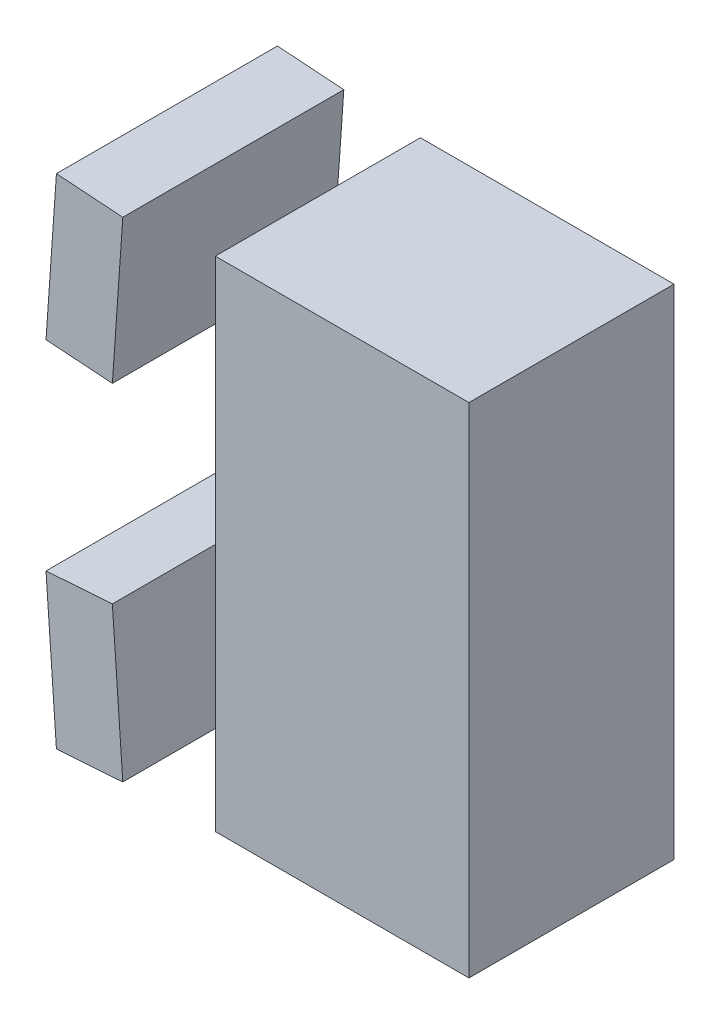
from build123d import *

# Parameters (mm, degrees)
BODY_DEPTH                     = 19.05
SKETCH4_R                      = 5.9436
F_10_HEAD_CLEARANCE_DEPTH      = 48.971655672
F_10_NUT_CLEARANCE_DEPTH       = 46.868801757
F_10_NUT_CLEARANCE_DEPTH_BACK  = 4.7625
FILLET2_R                      = 8.89
F_10_CLEARANCE_HOLE1_D         = 5.1054
FILLET3_R                      = 5.08
FILLET4_R                      = 2.54
F_10_CLEARANCE_HOLE2_D         = 5.1054
SKETCH11_W                     = 23.92163958
SKETCH11_H                     = 16.170942948
INFILL_BOX_MOUNT_DEPTH         = 7.2008
INFILL_BOUNDING_BOX_DEPTH      = 26.969445
INFILL_BOUNDING_BOX_DEPTH_BACK = 26.969445
SKETCH9_W                      = 27.451683019
SKETCH9_H                      = 22.196172726


# Read off the part's stored shape, not the designer's step: Body
with BuildPart() as part:
    # Body outline → Body (new body)
    with BuildSketch(Plane.XY):
        with BuildLine():
            ThreePointArc((19.563256599, 8.1915), (16.002518677, 13.919090379), (10.823670896, 18.239238727))
            Line((10.823670896, 18.239238727), (11.330509573, 25.487369503))
            Line((11.330509573, 25.487369503), (1.828711995, 26.151799916))
            Line((1.828711995, 26.151799916), (0.815034639, 11.655538363))
            ThreePointArc((0.815034639, 11.655538363), (11.684, 0), (0.815034639, -11.655538363))
            Line((0.815034639, -11.655538363), (1.828711995, -26.151799916))
            Line((1.828711995, -26.151799916), (11.330509573, -25.487369503))
            Line((11.330509573, -25.487369503), (10.823670896, -18.239238727))
            ThreePointArc((10.823670896, -18.239238727), (16.002518677, -13.919090379), (19.563256599, -8.1915))
            Line((19.563256599, -8.1915), (41.469504125, -8.1915))
            Line((41.469504125, -8.1915), (41.469504125, -5.0165))
            Line((41.469504125, -5.0165), (20.607193131, -5.0165))
            ThreePointArc((20.607193131, -5.0165), (20.948626487, -3.313114744), (21.149504125, -1.5875))
            Line((21.149504125, -1.5875), (41.469504125, -1.5875))
            Line((41.469504125, -1.5875), (41.469504125, 1.5875))
            Line((41.469504125, 1.5875), (21.149504125, 1.5875))
            ThreePointArc((21.149504125, 1.5875), (20.948626487, 3.313114744), (20.607193131, 5.0165))
            Line((20.607193131, 5.0165), (41.469504125, 5.0165))
            Line((41.469504125, 5.0165), (41.469504125, 8.1915))
            Line((41.469504125, 8.1915), (19.563256599, 8.1915))
        make_face()
    extrude(amount=BODY_DEPTH)

    # Sketch3 → CBORE for #10 Binding Head Machine Screw1 (revolve, cut)
    with BuildSketch(Plane(origin=(10.823670896, -18.239238727, 9.525), x_dir=(-0.06975647374412856, 0.9975640502598241, 0), z_dir=(0, 0, 1))):
        Polygon((0, 0), (0, 10.536208088), (2.5527, 10.536208088), (2.5527, 3.1242), (5.9436, 3.1242), (5.9436, 0), align=None)
    revolve(axis=Axis((17.158202615, -17.796285119, 9.525), (-0.9975640502598241, -0.06975647374412855, 0)), mode=Mode.SUBTRACT)

    # Sketch4 → #10 Head clearance (cut, through all)
    with BuildSketch(Plane(origin=(6.385207973, 0.446497237, 0), x_dir=(-0.06975647374412856, 0.9975640502598241, 0), z_dir=(0.9975640502598241, 0.06975647374412856, 0))):
        with Locations((-18.949829973, 9.525)):
            Circle(SKETCH4_R)
    extrude(amount=F_10_HEAD_CLEARANCE_DEPTH, mode=Mode.SUBTRACT)

    # Sketch5 → #10 nut clearance (cut, two sides: drawn at the far end of the back side and taken through both)
    with BuildSketch(Plane(origin=(9.501797579, -0.664430412, 0), x_dir=(-0.06975647374412855, -0.9975640502598241, 0), z_dir=(0.9975640502598241, -0.06975647374412855, 0)).offset(-F_10_NUT_CLEARANCE_DEPTH_BACK)):
        Polygon((-23.902829973, -6.665384117), (-23.902829973, -12.384615883), (-18.949829973, -15.244231767), (-13.996829973, -12.384615883), (-13.996829973, -6.665384117), (-18.949829973, -3.805768233), align=None)
    extrude(amount=F_10_NUT_CLEARANCE_DEPTH + F_10_NUT_CLEARANCE_DEPTH_BACK, mode=Mode.SUBTRACT)

    # Fillet2
    fillet2_edges = [part.edges().sort_by_distance(p)[0] for p in [
        (41.469504125, 6.604, 0),
        (41.469504125, 0, 0),
        (41.469504125, -6.604, 0),
        (41.469504125, -6.604, 19.05),
        (41.469504125, 0, 19.05),
        (41.469504125, 6.604, 19.05),
    ]]
    fillet(fillet2_edges, radius=FILLET2_R)

    # #10 Clearance Hole1 (through all)
    with Locations(Plane(origin=(0, -8.1915, 0), x_dir=(-1, 0, 0), z_dir=(0, -1, 0))):
        with Locations((-31.944504125, -9.525)):
            Hole(F_10_CLEARANCE_HOLE1_D / 2)

    # Fillet3
    fillet3_edges = [part.edges().sort_by_distance(p)[0] for p in [
        (19.563256599, 8.1915, 9.525),
        (19.563256599, -8.1915, 9.525),
    ]]
    fillet(fillet3_edges, radius=FILLET3_R)

    # Fillet4
    # the kernel refuses this fillet: 2.54 mm, written as the material it adds along each edge
    with BuildSketch(Plane(origin=(10.823670896, 18.239238727, 0), x_dir=(0.06975647364615441, 0.997564050266675, 0), z_dir=(0, 0, 1))) as fillet4_piece_1_section:
        with BuildLine():
            CenterArc((1.506239444, -2.54), FILLET4_R, 90, 59.467874794)
            ThreePointArc((-0.681575467, -1.249625668), (-0.330301403, -0.630532327), (0, 0))
            Line((0, 0), (1.506239444, 0))
        make_face()
    fillet4_piece_1 = extrude(amount=7.571366843, mode=Mode.PRIVATE)
    fillet4_piece_1 = split(fillet4_piece_1, bisect_by=Plane(origin=(11.045496334, 17.483235197, 3.379286412), z_dir=(0.034878236872064254, 0.49878202512991177, -0.8660254037844389)), keep=Keep.TOP, mode=Mode.PRIVATE)
    fillet4_piece_1 = split(fillet4_piece_1, bisect_by=Plane(origin=(11.16675059, 19.217251842, 3.228670408), z_dir=(-0.0348782368720643, -0.49878202512991243, -0.8660254037844384)), keep=Keep.TOP, mode=Mode.PRIVATE)
    add(fillet4_piece_1)
    with BuildSketch(Plane(origin=(10.823670896, 18.239238727, 0), x_dir=(0.06975647364615441, 0.997564050266675, 0), z_dir=(0, 0, 1))) as fillet4_piece_2_section:
        with BuildLine():
            CenterArc((1.506239444, -2.54), FILLET4_R, 90, 59.467874794)
            ThreePointArc((-0.681575467, -1.249625668), (-0.330301403, -0.630532327), (0, 0))
            Line((0, 0), (1.506239444, 0))
        make_face()
    fillet4_piece_2 = extrude(amount=7.571366843, mode=Mode.PRIVATE)
    fillet4_piece_2 = split(fillet4_piece_2, bisect_by=Plane(origin=(11.538192523, 17.902598899, 3.640659173), z_dir=(-0.034878236872064254, -0.49878202512991177, 0.8660254037844389)), keep=Keep.TOP, mode=Mode.PRIVATE)
    fillet4_piece_2 = split(fillet4_piece_2, bisect_by=Plane(origin=(11.538192523, 17.902598899, 3.970877294), z_dir=(-0.0348782368720643, -0.49878202512991243, -0.8660254037844384)), keep=Keep.TOP, mode=Mode.PRIVATE)
    add(fillet4_piece_2)
    with BuildSketch(Plane(origin=(10.823670896, 18.239238727, 0), x_dir=(0.06975647364615441, 0.997564050266675, 0), z_dir=(0, 0, 1))) as fillet4_piece_3_section:
        with BuildLine():
            CenterArc((1.506239444, -2.54), FILLET4_R, 90, 59.467874794)
            ThreePointArc((-0.681575467, -1.249625668), (-0.330301403, -0.630532327), (0, 0))
            Line((0, 0), (1.506239444, 0))
        make_face()
    fillet4_piece_3 = extrude(amount=7.571366843, mode=Mode.PRIVATE)
    fillet4_piece_3 = split(fillet4_piece_3, bisect_by=Plane(origin=(10.910701379, 18.802736053, 4.133816124), z_dir=(0.034878236872064254, 0.49878202512991177, -0.8660254037844389)), keep=Keep.TOP, mode=Mode.PRIVATE)
    fillet4_piece_3 = split(fillet4_piece_3, bisect_by=Plane(origin=(10.910701379, 18.802736053, 3.477720343), z_dir=(0.0348782368720643, 0.49878202512991243, 0.8660254037844384)), keep=Keep.TOP, mode=Mode.PRIVATE)
    add(fillet4_piece_3)
    with BuildSketch(Plane(origin=(10.823670896, 18.239238727, 11.478633157), x_dir=(0.06975647364615441, 0.997564050266675, 0), z_dir=(0, 0, 1))) as fillet4_piece_4_section:
        with BuildLine():
            CenterArc((1.506239444, -2.54), FILLET4_R, 90, 59.467874794)
            ThreePointArc((-0.681575467, -1.249625668), (-0.330301403, -0.630532327), (0, 0))
            Line((0, 0), (1.506239444, 0))
        make_face()
    fillet4_piece_4 = extrude(amount=7.571366843, mode=Mode.PRIVATE)
    fillet4_piece_4 = split(fillet4_piece_4, bisect_by=Plane(origin=(11.538192523, 17.902598899, 15.409340827), z_dir=(-0.03487823687206431, -0.4987820251299125, -0.8660254037844386)), keep=Keep.TOP, mode=Mode.PRIVATE)
    fillet4_piece_4 = split(fillet4_piece_4, bisect_by=Plane(origin=(11.538192523, 17.902598899, 15.079122706), z_dir=(-0.034878236872064254, -0.49878202512991177, 0.8660254037844388)), keep=Keep.TOP, mode=Mode.PRIVATE)
    add(fillet4_piece_4)
    with BuildSketch(Plane(origin=(10.823670896, 18.239238727, 11.478633157), x_dir=(0.06975647364615441, 0.997564050266675, 0), z_dir=(0, 0, 1))) as fillet4_piece_5_section:
        with BuildLine():
            CenterArc((1.506239444, -2.54), FILLET4_R, 90, 59.467874794)
            ThreePointArc((-0.681575467, -1.249625668), (-0.330301403, -0.630532327), (0, 0))
            Line((0, 0), (1.506239444, 0))
        make_face()
    fillet4_piece_5 = extrude(amount=7.571366843, mode=Mode.PRIVATE)
    fillet4_piece_5 = split(fillet4_piece_5, bisect_by=Plane(origin=(10.910701379, 18.802736053, 14.916183876), z_dir=(0.03487823687206431, 0.4987820251299125, 0.8660254037844386)), keep=Keep.TOP, mode=Mode.PRIVATE)
    fillet4_piece_5 = split(fillet4_piece_5, bisect_by=Plane(origin=(10.910701379, 18.802736053, 15.572279657), z_dir=(0.034878236872064254, 0.49878202512991177, -0.8660254037844388)), keep=Keep.TOP, mode=Mode.PRIVATE)
    add(fillet4_piece_5)
    with BuildSketch(Plane(origin=(10.823670896, 18.239238727, 11.478633157), x_dir=(0.06975647364615441, 0.997564050266675, 0), z_dir=(0, 0, 1))) as fillet4_piece_6_section:
        with BuildLine():
            CenterArc((1.506239444, -2.54), FILLET4_R, 90, 59.467874794)
            ThreePointArc((-0.681575467, -1.249625668), (-0.330301403, -0.630532327), (0, 0))
            Line((0, 0), (1.506239444, 0))
        make_face()
    fillet4_piece_6 = extrude(amount=7.571366843, mode=Mode.PRIVATE)
    fillet4_piece_6 = split(fillet4_piece_6, bisect_by=Plane(origin=(11.045496334, 17.483235197, 15.670713588), z_dir=(0.03487823687206431, 0.4987820251299125, 0.8660254037844386)), keep=Keep.TOP, mode=Mode.PRIVATE)
    fillet4_piece_6 = split(fillet4_piece_6, bisect_by=Plane(origin=(11.16675059, 19.217251842, 15.821329592), z_dir=(-0.034878236872064254, -0.49878202512991177, 0.8660254037844388)), keep=Keep.TOP, mode=Mode.PRIVATE)
    add(fillet4_piece_6)
    with BuildSketch(Plane(origin=(10.823670896, -18.239238727, 0), x_dir=(0.8423668352181145, 0.5389045508479382, 0), z_dir=(0, 0, 1))) as fillet4_piece_7_section:
        with BuildLine():
            CenterArc((1.50864912, -2.538569498), FILLET4_R, 91.92302723, 59.467874794)
            Line((-0.721234541, -1.322338081), (0, 0))
            ThreePointArc((0, 0), (0.711707353, -0.011944694), (1.423414707, 0))
        make_face()
    fillet4_piece_7 = extrude(amount=7.34699861, mode=Mode.PRIVATE)
    fillet4_piece_7 = fillet4_piece_7 - Plane(origin=(11.093024208, -18.220403709, 9.525), x_dir=(-0.06975647374412856, 0.9975640502598241, 0), z_dir=(-0.9975640502598241, -0.06975647374412856, 0)) * Cylinder(5.9436, 21, mode=Mode.PRIVATE)
    add(fillet4_piece_7)
    with BuildSketch(Plane(origin=(10.823670896, -18.239238727, 11.70300139), x_dir=(0.8423668352181142, 0.5389045508479389, 0), z_dir=(0, 0, 1))) as fillet4_piece_8_section:
        with BuildLine():
            CenterArc((1.50864912, -2.538569498), FILLET4_R, 91.92302723, 59.467874794)
            Line((-0.721234541, -1.322338081), (0, 0))
            ThreePointArc((0, 0), (0.711707353, -0.011944694), (1.423414707, 0))
        make_face()
    fillet4_piece_8 = extrude(amount=7.34699861, mode=Mode.PRIVATE)
    fillet4_piece_8 = fillet4_piece_8 - Plane(origin=(11.09302416, -18.220403712, 9.525), x_dir=(-0.06975647374412856, 0.9975640502598241, 0), z_dir=(-0.9975640502598241, -0.06975647374412856, 0)) * Cylinder(5.9436, 21, mode=Mode.PRIVATE)
    add(fillet4_piece_8)
    # the kernel refuses this fillet: 2.54 mm, written as the material it takes off along each edge
    with BuildSketch(Plane(origin=(11.330509573, -25.487369503, -6.349999999), x_dir=(-0.06975647364615452, 0.997564050266675, 0), z_dir=(0, 0, 1)), Plane(origin=(11.330509573, 25.487369503, -6.349999999), x_dir=(-0.997564050255164, 0.06975647381076958, 0), z_dir=(0, 0, 1))) as fillet4_2_piece_1:
        with BuildLine():
            CenterArc((FILLET4_R, FILLET4_R), FILLET4_R, 180.000000009, 89.999999991)
            Line((-FILLET4_R * 1.65018418464e-10, FILLET4_R), (0, 0))
            Line((0, 0), (FILLET4_R, 0))
        make_face()
    extrude(amount=31.749999998, mode=Mode.SUBTRACT)
    with BuildSketch(Plane(origin=(1.828711995, -26.151799916, -6.35), x_dir=(0.9975640502551639, 0.0697564738107699, 0), z_dir=(0, 0, 1)), Plane(origin=(1.828711995, 26.151799916, -6.35), x_dir=(-0.06975647377832653, -0.9975640502574327, 0), z_dir=(0, 0, 1))) as fillet4_2_piece_2:
        with BuildLine():
            CenterArc((FILLET4_R, FILLET4_R), FILLET4_R, 179.999999998, 90.000000002)
            Line((0, FILLET4_R), (0, 0))
            Line((0, 0), (FILLET4_R, 0))
        make_face()
    extrude(amount=31.75, mode=Mode.SUBTRACT)
    with BuildSketch(Plane(origin=(0.815034639, -11.655538363, -5.778442378), x_dir=(0.06975647377832637, -0.9975640502574326, 0), z_dir=(0, 0, 1))) as fillet4_2_piece_3:
        with BuildLine():
            CenterArc((2.311376951, 2.54), FILLET4_R, 190.286560608, 79.713439392)
            ThreePointArc((-0.187797504, 2.086428572), (-0.047044084, 1.047431631), (0, 0))
            Line((0, 0), (2.311376951, 0))
        make_face()
    extrude(amount=30.606884756, mode=Mode.SUBTRACT)
    with BuildSketch(Plane(origin=(0.815034639, 11.655538363, -5.778442378), x_dir=(0.9872940550084358, -0.1589038984575255, 0), z_dir=(0, 0, 1))) as fillet4_2_piece_4:
        with BuildLine():
            CenterArc((2.322565791, 2.529773025), FILLET4_R, 185.143280302, 79.713439392)
            Line((-0.207207235, 2.302070497), (0, 0))
            ThreePointArc((0, 0), (1.047431631, 0.047044085), (2.094863262, 0))
        make_face()
    extrude(amount=30.606884756, mode=Mode.SUBTRACT)

    # #10 Clearance Hole2 (through all)
    with Locations(Plane(origin=(4.750898789, -0.332215206, 0), x_dir=(0, 0, -1), z_dir=(0.9975640502598241, -0.06975647374412854, 0))):
        with Locations((-9.525, 18.949829973)):
            Hole(F_10_CLEARANCE_HOLE2_D / 2)


with BuildPart() as body_2:
    # Sketch11 → Infill box -mount (new body)
    with BuildSketch(Plane(origin=(0, 0, 0), x_dir=(0, 0, 1), z_dir=(-0.9975640502598241, -0.06975647374412852, 0))):
        with Locations((9.525, -18.949829973)):
            Rectangle(SKETCH11_W, SKETCH11_H)
    extrude(amount=-INFILL_BOX_MOUNT_DEPTH)


with BuildPart() as body_3:
    # Mirror3: mirrored copy
    add(body_2.part.mirror(Plane.ZX))


with BuildPart() as body_4:
    # Sketch9 → Infill bounding box (new, two sides: drawn at the far end of the back side and taken through both)
    with BuildSketch(Plane(origin=(0, 0, 0), x_dir=(1, 0, 0), z_dir=(0, 1, 0)).offset(-INFILL_BOUNDING_BOX_DEPTH_BACK)):
        with Locations((31.944504126, -9.525)):
            Rectangle(SKETCH9_W, SKETCH9_H)
    extrude(amount=INFILL_BOUNDING_BOX_DEPTH + INFILL_BOUNDING_BOX_DEPTH_BACK)


solid = Compound([body_2.part, body_3.part, body_4.part])
